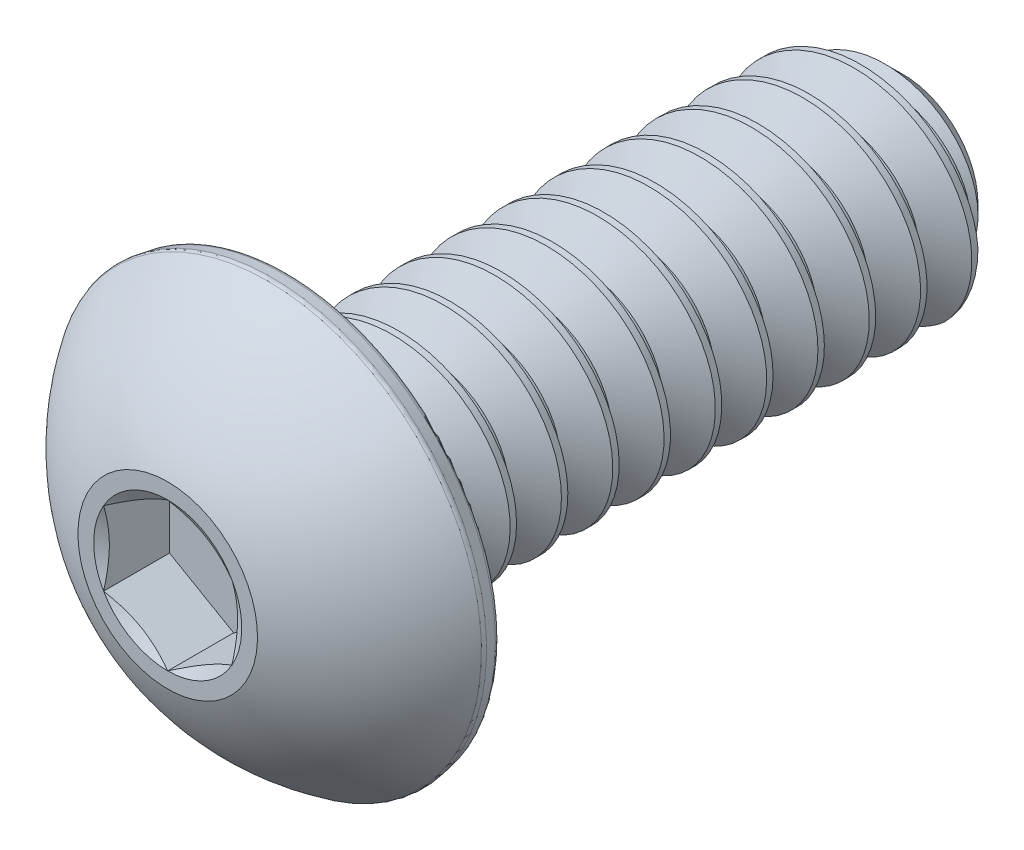
from build123d import *

# Parameters (mm, degrees)
CUT_EXTRUDE1_DEPTH = 1.01981
FILLET1_R          = 0.09271
CUT_SWEEP1_PITCH   = 0.79375
CUT_SWEEP1_TO      = 9.525


with BuildPart() as part:
    # Sketch3 → Revolve1 (revolve)
    with BuildSketch(Plane(origin=(0, 0, 0), x_dir=(0, 0, -1), z_dir=(1, 0, 0)), mode=Mode.PRIVATE) as revolve1_sk:
        with BuildLine():
            Line((-5.6896, 0), (-5.6896, 1.3890625))
            ThreePointArc((-5.6896, 1.3890625), (-5.059210995, 2.486413841), (-4.11353, 3.3274))
            Line((-4.11353, 3.3274), (-3.8354, 3.278358177))
            Line((-3.8354, 3.278358177), (-3.8354, 1.7526))
            Line((-3.8354, 1.7526), (5.0942875, 1.7526))
            Line((5.0942875, 1.7526), (5.6896, 1.1572875))
            Line((5.6896, 1.1572875), (5.6896, 0))
            Line((5.6896, 0), (-5.6896, 0))
        make_face()
    revolve(revolve1_sk.sketch.rotate(Axis((0, 0, 5.6896), (0, 0, -1)), 90), axis=Axis((0, 0, 5.6896), (0, 0, -1)))

    # Sketch4 → Cut-Extrude1 (cut)
    with BuildSketch(Plane.XY.offset(5.6896)):
        Polygon((-0.9921875, -0.57283972), (0, -1.14567944), (0.9921875, -0.57283972), (0.9921875, 0.57283972), (0, 1.14567944), (-0.9921875, 0.57283972), align=None)
    extrude(amount=-CUT_EXTRUDE1_DEPTH, mode=Mode.SUBTRACT)

    # Cut-Extrude2 cone 1 section (through the dimple's axis) → Cut-Extrude2 (revolve, cut)
    with BuildSketch(Plane(origin=(0, 0, 5.6896), x_dir=(0, -1, 0), z_dir=(1, 0, 0))):
        Polygon((0, 0), (1.14567944, 0), (0, 0.661458333), align=None)
    revolve(axis=Axis((0, 0, 5.6896), (0, 0, -1)), mode=Mode.SUBTRACT)

    # Fillet1
    fillet1_edges = [part.edges().sort_by_distance(p)[0] for p in [
        (-3.278358177, 0, 3.8354),
        (-3.3274, 0, 4.11353),
    ]]
    fillet(fillet1_edges, radius=FILLET1_R)


with BuildPart() as body_2:
    # Split1: read off the stored shape, not the designer's step
    # Split1: the piece on the far side of the plane
    add(part.part)
    split(bisect_by=Plane.XY.offset(3.8354), keep=Keep.BOTTOM)

    # Cut-Sweep1: arcs per turn and ends read off the stored shape
    # Cut-Sweep1: the profile of Sketch7 screwed along a right-hand helix through 13 turns, 8 arcs to a turn; built about Z, then put on its axis
    cut_sweep1_z = Axis((0, 0, 0), (0, 0, 1))
    cut_sweep1_corners = [(1.795562979, 0, 0.024804687), (1.795562979, 0, -0.719335938), (1.237044252, 0, -0.396875), (1.237044252, 0, -0.29765625)]
    with BuildLine(mode=Mode.PRIVATE) as cut_sweep1_profile:
        Line(cut_sweep1_corners[0], cut_sweep1_corners[1])
        Line(cut_sweep1_corners[1], cut_sweep1_corners[2])
        Line(cut_sweep1_corners[2], cut_sweep1_corners[3])
        Line(cut_sweep1_corners[3], cut_sweep1_corners[0])
    cut_sweep1_cap = Face(cut_sweep1_profile.wire())
    cut_sweep1_turn_angles = [0, 22.5, 45, 67.5, 90, 112.5, 135, 157.5, 180, 202.5, 225, 247.5, 270, 292.5, 315, 337.5, 360]
    cut_sweep1_turn_weights = [1, 0.9238795325112867, 1, 0.9238795325112867, 1, 0.9238795325112867, 1, 0.9238795325112867, 1, 0.9238795325112867, 1, 0.9238795325112867, 1, 0.9238795325112867, 1, 0.9238795325112867, 1]
    cut_sweep1_turn_rails = [Edge.make_bspline([Vector(p[0], p[1], 0).rotate(cut_sweep1_z, cut_sweep1_turn_angles[k]) / cut_sweep1_turn_weights[k] + Vector(0, 0, p[2] + CUT_SWEEP1_PITCH * cut_sweep1_turn_angles[k] / 360) for k in range(17)], [0, 0, 0, 1, 1, 2, 2, 3, 3, 4, 4, 5, 5, 6, 6, 7, 7, 8, 8, 8], 2, cut_sweep1_turn_weights) for p in cut_sweep1_corners]
    cut_sweep1_turn_sides = [Face.make_surface_from_curves(cut_sweep1_turn_rails[p[0]], cut_sweep1_turn_rails[p[1]]) for p in [(0, 1), (1, 2), (2, 3), (3, 0)]]
    cut_sweep1 = Plane(origin=(0, 0, -5.6896), x_dir=(0, 1, 0), z_dir=(0, 0, 1)) * split(Solid(Shell([*[p.moved(Location((0, 0, CUT_SWEEP1_PITCH * i))) for i in range(13) for p in cut_sweep1_turn_sides], cut_sweep1_cap, cut_sweep1_cap.rotate(cut_sweep1_z, 4680).moved(Location((0, 0, CUT_SWEEP1_PITCH * 4680 / 360)))])), bisect_by=Plane.XY.offset(CUT_SWEEP1_TO), keep=Keep.BOTTOM, mode=Mode.PRIVATE)
    add(cut_sweep1, mode=Mode.SUBTRACT)


with BuildPart() as part_1:
    add(part.part)

    # Split1
    split(bisect_by=Plane.XY.offset(3.8354), keep=Keep.TOP)

    add(body_2.part)  # Boss-Extrude1 merges body 2
    # Boss-Extrude1 cone 1 section (through the dimple's axis) → Boss-Extrude1 (revolve)
    with BuildSketch(Plane(origin=(0, 0, 3.8354), x_dir=(0, -1, 0), z_dir=(1, 0, 0))):
        Polygon((0, 0), (1.838525958, 0), (0, 1.838525958), align=None)
    revolve(axis=Axis((0, 0, 3.8354), (0, 0, -1)))


solid = part_1.part
